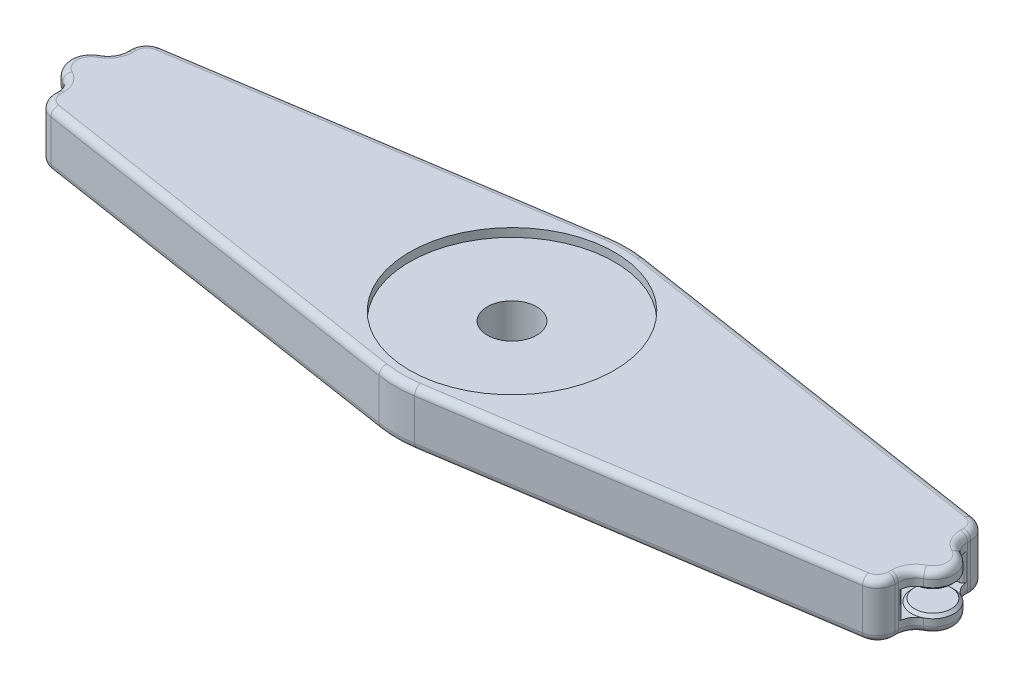
from build123d import *

# Parameters (mm, degrees)
SKETCH1_R             = 3.5
BOSS_EXTRUDE1_DEPTH   = 2
SKETCH2_R             = 2.5
BOSS_EXTRUDE2_DEPTH   = 0.4
SKETCH3_R             = 2
BOSS_EXTRUDE3_DEPTH   = 3
SKETCH5_R             = 2.5
BOSS_EXTRUDE4_DEPTH   = 0.4
SKETCH4_R             = 3.5
BOSS_EXTRUDE5_DEPTH   = 3.8
SKETCH6_R             = 3.5
BOSS_EXTRUDE6_DEPTH   = 2
SKETCH9_R             = 14.5
CUT_EXTRUDE3_DEPTH    = 1.2
CUT_EXTRUDE5_START    = -1
SKETCH12_R            = 2
CUT_EXTRUDE5_DEPTH    = 65.187010976
CHAMFER1_SIZE         = 0.5
SKETCH13_R            = 2.1
CUT_EXTRUDE6_DEPTH    = 4.8
FILLET4_R             = 0.5
FILLET5_R             = 1
DELETEFACE1_START     = 1
DELETEFACE1_OUTLINE_R = 2
DELETEFACE1_DEPTH     = 1.4
DELETEFACE2_START     = 5.4
DELETEFACE2_OUTLINE_R = 2
DELETEFACE2_DEPTH     = 2.4


with BuildPart() as part:
    # Sketch1 → Boss-Extrude1 (new body)
    with BuildSketch(Plane(origin=(0, 0, 0), x_dir=(1, 0, 0), z_dir=(0, 1, 0))):
        with BuildLine():
            ThreePointArc((-59.58, 5.356241329), (-58.977803306, 6.983614247), (-57.461325911, 7.826988291))
            Line((-57.461325911, 7.826988291), (-2.516751014, 16.306929948))
            ThreePointArc((-2.516751014, 16.306929948), (0, 16.5), (2.516751014, 16.306929948))
            Line((2.516751014, 16.306929948), (57.461325911, 7.826988291))
            ThreePointArc((57.461325911, 7.826988291), (58.977803306, 6.983614247), (59.58, 5.356241329))
            Line((59.58, 5.356241329), (59.58, 4.898979486))
            ThreePointArc((59.58, 4.898979486), (59.947992836, 3.593397066), (60.943636364, 2.672170628))
            ThreePointArc((60.943636364, 2.672170628), (62.58, 0), (60.943636364, -2.672170628))
            ThreePointArc((60.943636364, -2.672170628), (59.947992836, -3.593397066), (59.58, -4.898979486))
            Line((59.58, -4.898979486), (59.58, -5.356241329))
            ThreePointArc((59.58, -5.356241329), (58.977803306, -6.983614247), (57.461325911, -7.826988291))
            Line((57.461325911, -7.826988291), (2.516751014, -16.306929948))
            ThreePointArc((2.516751014, -16.306929948), (0, -16.5), (-2.516751014, -16.306929948))
            Line((-2.516751014, -16.306929948), (-57.461325911, -7.826988291))
            ThreePointArc((-57.461325911, -7.826988291), (-58.977803306, -6.983614247), (-59.58, -5.356241329))
            Line((-59.58, -5.356241329), (-59.58, -4.898979486))
            ThreePointArc((-59.58, -4.898979486), (-59.947992836, -3.593397066), (-60.943636364, -2.672170628))
            ThreePointArc((-60.943636364, -2.672170628), (-62.58, 0), (-60.943636364, 2.672170628))
            ThreePointArc((-60.943636364, 2.672170628), (-59.947992836, 3.593397066), (-59.58, 4.898979486))
            Line((-59.58, 4.898979486), (-59.58, 5.356241329))
        make_face()
        with Locations(Location((0, 0, 0), (0, 0, 270))):
            Circle(SKETCH1_R, mode=Mode.SUBTRACT)
    extrude(amount=BOSS_EXTRUDE1_DEPTH)

    # Sketch2 → Boss-Extrude2 (add)
    with BuildSketch(Plane(origin=(0, 2, 0), x_dir=(1, 0, 0), z_dir=(0, 1, 0))):
        with Locations(Location((-59.58, 0, 0), (0, 0, 270))):
            Circle(SKETCH2_R)
        with Locations(Location((59.58, 0, 0), (0, 0, 270))):
            Circle(SKETCH2_R)
    extrude(amount=BOSS_EXTRUDE2_DEPTH)

    # Sketch3 → Boss-Extrude3 (add)
    with BuildSketch(Plane(origin=(0, 2.4, 0), x_dir=(1, 0, 0), z_dir=(0, 1, 0))):
        with Locations(Location((-59.58, 0, 0), (0, 0, 270))):
            Circle(SKETCH3_R)
        with Locations(Location((59.58, 0, 0), (0, 0, 270))):
            Circle(SKETCH3_R)
    extrude(amount=BOSS_EXTRUDE3_DEPTH)

    # Sketch5 → Boss-Extrude4 (add)
    with BuildSketch(Plane(origin=(0, 5.4, 0), x_dir=(1, 0, 0), z_dir=(0, 1, 0))):
        with Locations(Location((-59.58, 0, 0), (0, 0, 270))):
            Circle(SKETCH5_R)
        with Locations(Location((59.58, 0, 0), (0, 0, 270))):
            Circle(SKETCH5_R)
    extrude(amount=BOSS_EXTRUDE4_DEPTH)

    # Sketch4 → Boss-Extrude5 (add)
    with BuildSketch(Plane(origin=(0, 2, 0), x_dir=(1, 0, 0), z_dir=(0, 1, 0))):
        with BuildLine():
            Line((-59.58, 5.356241329), (-59.58, 4.898979486))
            ThreePointArc((-59.58, 4.898979486), (-59.581062452, 4.826101989), (-59.584248904, 4.753286436))
            ThreePointArc((-59.584248904, 4.753286436), (-59.46621099, 4.400491511), (-59.13719356, 4.226869108))
            ThreePointArc((-59.13719356, 4.226869108), (-55.33, 0), (-59.13719356, -4.226869108))
            ThreePointArc((-59.13719356, -4.226869108), (-59.46621099, -4.400491511), (-59.584248904, -4.753286436))
            ThreePointArc((-59.584248904, -4.753286436), (-59.581062452, -4.826101989), (-59.58, -4.898979486))
            Line((-59.58, -4.898979486), (-59.58, -5.356241329))
            ThreePointArc((-59.58, -5.356241329), (-58.977803306, -6.983614247), (-57.461325911, -7.826988291))
            Line((-57.461325911, -7.826988291), (-2.516751014, -16.306929948))
            ThreePointArc((-2.516751014, -16.306929948), (0, -16.5), (2.516751014, -16.306929948))
            Line((2.516751014, -16.306929948), (57.461325911, -7.826988291))
            ThreePointArc((57.461325911, -7.826988291), (58.977803306, -6.983614247), (59.58, -5.356241329))
            Line((59.58, -5.356241329), (59.58, -4.898979486))
            ThreePointArc((59.58, -4.898979486), (59.581062452, -4.826101989), (59.584248904, -4.753286436))
            ThreePointArc((59.584248904, -4.753286436), (59.46621099, -4.400491511), (59.13719356, -4.226869108))
            ThreePointArc((59.13719356, -4.226869108), (55.33, 0), (59.13719356, 4.226869108))
            ThreePointArc((59.13719356, 4.226869108), (59.46621099, 4.400491511), (59.584248904, 4.753286436))
            ThreePointArc((59.584248904, 4.753286436), (59.581062452, 4.826101989), (59.58, 4.898979486))
            Line((59.58, 4.898979486), (59.58, 5.356241329))
            ThreePointArc((59.58, 5.356241329), (58.977803306, 6.983614247), (57.461325911, 7.826988291))
            Line((57.461325911, 7.826988291), (2.516751014, 16.306929948))
            ThreePointArc((2.516751014, 16.306929948), (0, 16.5), (-2.516751014, 16.306929948))
            Line((-2.516751014, 16.306929948), (-57.461325911, 7.826988291))
            ThreePointArc((-57.461325911, 7.826988291), (-58.977803306, 6.983614247), (-59.58, 5.356241329))
        make_face()
        with Locations(Location((0, 0, 0), (0, 0, 270))):
            Circle(SKETCH4_R, mode=Mode.SUBTRACT)
    extrude(amount=BOSS_EXTRUDE5_DEPTH)

    # Sketch6 → Boss-Extrude6 (add)
    with BuildSketch(Plane(origin=(0, 5.8, 0), x_dir=(1, 0, 0), z_dir=(0, 1, 0))):
        with BuildLine():
            Line((-2.516751014, 16.306929948), (-57.461325911, 7.826988291))
            ThreePointArc((-57.461325911, 7.826988291), (-58.977803306, 6.983614247), (-59.58, 5.356241329))
            Line((-59.58, 5.356241329), (-59.58, 4.898979486))
            ThreePointArc((-59.58, 4.898979486), (-59.947992836, 3.593397066), (-60.943636364, 2.672170628))
            ThreePointArc((-60.943636364, 2.672170628), (-62.58, 0), (-60.943636364, -2.672170628))
            ThreePointArc((-60.943636364, -2.672170628), (-59.947992836, -3.593397066), (-59.58, -4.898979486))
            Line((-59.58, -4.898979486), (-59.58, -5.356241329))
            ThreePointArc((-59.58, -5.356241329), (-58.977803306, -6.983614247), (-57.461325911, -7.826988291))
            Line((-57.461325911, -7.826988291), (-2.516751014, -16.306929948))
            ThreePointArc((-2.516751014, -16.306929948), (0, -16.5), (2.516751014, -16.306929948))
            Line((2.516751014, -16.306929948), (57.461325911, -7.826988291))
            ThreePointArc((57.461325911, -7.826988291), (58.977803306, -6.983614247), (59.58, -5.356241329))
            Line((59.58, -5.356241329), (59.58, -4.898979486))
            ThreePointArc((59.58, -4.898979486), (59.947992836, -3.593397066), (60.943636364, -2.672170628))
            ThreePointArc((60.943636364, -2.672170628), (62.58, 0), (60.943636364, 2.672170628))
            ThreePointArc((60.943636364, 2.672170628), (59.947992836, 3.593397066), (59.58, 4.898979486))
            Line((59.58, 4.898979486), (59.58, 5.356241329))
            ThreePointArc((59.58, 5.356241329), (58.977803306, 6.983614247), (57.461325911, 7.826988291))
            Line((57.461325911, 7.826988291), (2.516751014, 16.306929948))
            ThreePointArc((2.516751014, 16.306929948), (0, 16.5), (-2.516751014, 16.306929948))
        make_face()
        with Locations(Location((0, 0, 0), (0, 0, 270))):
            Circle(SKETCH6_R, mode=Mode.SUBTRACT)
    extrude(amount=BOSS_EXTRUDE6_DEPTH)

    # Sketch9 → Cut-Extrude3 (cut)
    with BuildSketch(Plane(origin=(0, 7.8, 0), x_dir=(1, 0, 0), z_dir=(0, 1, 0))):
        with Locations(Location((0, 0, 0), (0, 0, 270))):
            Circle(SKETCH9_R)
    extrude(amount=-CUT_EXTRUDE3_DEPTH, mode=Mode.SUBTRACT)

    # Sketch12 → Cut-Extrude5 (cut, through all)
    with BuildSketch(Plane.XZ.offset(CUT_EXTRUDE5_START)):
        with Locations(Location((-59.58, 0, 0), (0, 0, 270))):
            Circle(SKETCH12_R)
        with Locations(Location((59.58, 0, 0), (0, 0, 270))):
            Circle(SKETCH12_R)
    extrude(amount=-CUT_EXTRUDE5_DEPTH, mode=Mode.SUBTRACT)

    # Chamfer1
    # the kernel refuses this chamfer: 0.5 mm, written as the material it adds along each edge
    with BuildSketch(Plane(origin=(-59.58, 5.8, 0), x_dir=(0, 0, 1), z_dir=(-1, 0, 0))) as chamfer1_piece_1_section:
        Polygon((2.5, -CHAMFER1_SIZE), (2.5 + CHAMFER1_SIZE, 0), (2.5, 0), align=None)
    chamfer1_piece_1 = revolve(axis=Axis((-59.58, 5.8, 0), (0, 1, 0)), mode=Mode.PRIVATE)
    chamfer1_piece_1 = split(chamfer1_piece_1, bisect_by=Plane(origin=(-59.58, 5.4, 0), z_dir=(0, 1, 0)), keep=Keep.TOP, mode=Mode.PRIVATE)
    add(chamfer1_piece_1)
    with BuildSketch(Plane(origin=(-59.58, 2, 0), x_dir=(0, 0, 1), z_dir=(-1, 0, 0))) as chamfer1_piece_2_section:
        Polygon((2.5 + CHAMFER1_SIZE, 0), (2.5, CHAMFER1_SIZE), (2.5, 0), align=None)
    chamfer1_piece_2 = revolve(axis=Axis((-59.58, 2, 0), (0, 1, 0)), mode=Mode.PRIVATE)
    chamfer1_piece_2 = split(chamfer1_piece_2, bisect_by=Plane(origin=(-59.58, 2.4, 0), z_dir=(0, -1, 0)), keep=Keep.TOP, mode=Mode.PRIVATE)
    add(chamfer1_piece_2)
    with BuildSketch(Plane(origin=(59.58, 5.8, 0), x_dir=(0, 0, 1), z_dir=(-1, 0, 0))) as chamfer1_piece_3_section:
        Polygon((2.5 + CHAMFER1_SIZE, 0), (2.5, -CHAMFER1_SIZE), (2.5, 0), align=None)
    chamfer1_piece_3 = revolve(axis=Axis((59.58, 5.8, 0), (0, 1, 0)), mode=Mode.PRIVATE)
    chamfer1_piece_3 = split(chamfer1_piece_3, bisect_by=Plane(origin=(59.58, 5.4, 0), z_dir=(0, 1, 0)), keep=Keep.TOP, mode=Mode.PRIVATE)
    add(chamfer1_piece_3)
    with BuildSketch(Plane(origin=(59.58, 2, 0), x_dir=(0, 0, 1), z_dir=(-1, 0, 0))) as chamfer1_piece_4_section:
        Polygon((2.5 + CHAMFER1_SIZE, 0), (2.5, CHAMFER1_SIZE), (2.5, 0), align=None)
    chamfer1_piece_4 = revolve(axis=Axis((59.58, 2, 0), (0, 1, 0)), mode=Mode.PRIVATE)
    chamfer1_piece_4 = split(chamfer1_piece_4, bisect_by=Plane(origin=(59.58, 2.4, 0), z_dir=(0, -1, 0)), keep=Keep.TOP, mode=Mode.PRIVATE)
    add(chamfer1_piece_4)

    # Sketch13 → Cut-Extrude6 (cut)
    with BuildSketch(Plane.XZ):
        with Locations(Location((0, 10, 0), (0, 0, 270))):
            Circle(SKETCH13_R)
        with Locations(Location((8.660254038, -5, 0), (0, 0, 270))):
            Circle(SKETCH13_R)
        with Locations(Location((-8.660254038, -5, 0), (0, 0, 270))):
            Circle(SKETCH13_R)
    extrude(amount=-CUT_EXTRUDE6_DEPTH, mode=Mode.SUBTRACT)

    # Fillet4
    fillet4_edges = [part.edges().sort_by_distance(p)[0] for p in [
        (0, 0, 12.1),
        (8.660254038, 0, -2.9),
        (-8.660254038, 0, -2.9),
    ]]
    fillet(fillet4_edges, radius=FILLET4_R)

    # Fillet5
    fillet5_edges = [part.edges().sort_by_distance(p)[0] for p in [
        (-58.977803306, 7.8, -6.983614247),
        (-59.58, 7.8, -5.127610408),
        (-59.947992836, 7.8, -3.593397066),
        (-62.58, 7.8, 0),
        (-59.947992836, 7.8, 3.593397066),
        (-59.58, 7.8, 5.127610408),
        (-58.977803306, 7.8, 6.983614247),
        (-29.989038462, 7.8, 12.06695912),
        (0, 7.8, 16.5),
        (29.989038462, 7.8, 12.06695912),
        (58.977803306, 7.8, 6.983614247),
        (59.58, 7.8, 5.127610408),
        (59.947992836, 7.8, 3.593397066),
        (62.58, 7.8, 0),
        (59.947992836, 7.8, -3.593397066),
        (59.58, 7.8, -5.127610408),
        (58.977803306, 7.8, -6.983614247),
        (29.989038462, 7.8, -12.06695912),
        (0, 7.8, -16.5),
        (-29.989038462, 7.8, -12.06695912),
        (-29.989038462, 0, -12.06695912),
        (0, 0, -16.5),
        (29.989038462, 0, -12.06695912),
        (58.977803306, 0, -6.983614247),
        (59.58, 0, -5.127610408),
        (59.947992836, 0, -3.593397066),
        (62.58, 0, 0),
        (59.947992836, 0, 3.593397066),
        (59.58, 0, 5.127610408),
        (58.977803306, 0, 6.983614247),
        (29.989038462, 0, 12.06695912),
        (0, 0, 16.5),
        (-29.989038462, 0, 12.06695912),
        (-58.977803306, 0, 6.983614247),
        (-59.58, 0, 5.127610408),
        (-59.947992836, 0, 3.593397066),
        (-62.58, 0, 0),
        (-59.947992836, 0, -3.593397066),
        (-59.58, 0, -5.127610408),
        (-58.977803306, 0, -6.983614247),
    ]]
    fillet(fillet5_edges, radius=FILLET5_R - 0.0001)  # a hair under: the kernel refuses the full size

    # DeleteFace1: read off the stored shape, not the designer's step
    # DeleteFace1 outline → DeleteFace1 (add)
    with BuildSketch(Plane(origin=(0, 0, 0), x_dir=(1, 0, 0), z_dir=(0, 1, 0)).offset(DELETEFACE1_START)):
        with Locations((59.58, 0)):
            Circle(DELETEFACE1_OUTLINE_R)
        with Locations((-59.58, 0)):
            Circle(DELETEFACE1_OUTLINE_R)
    extrude(amount=DELETEFACE1_DEPTH)

    # DeleteFace2: read off the stored shape, not the designer's step
    # DeleteFace2 outline → DeleteFace2 (add)
    with BuildSketch(Plane(origin=(0, 0, 0), x_dir=(1, 0, 0), z_dir=(0, 1, 0)).offset(DELETEFACE2_START)):
        with Locations((59.58, 0)):
            Circle(DELETEFACE2_OUTLINE_R)
        with Locations((-59.58, 0)):
            Circle(DELETEFACE2_OUTLINE_R)
    extrude(amount=DELETEFACE2_DEPTH)


solid = part.part
